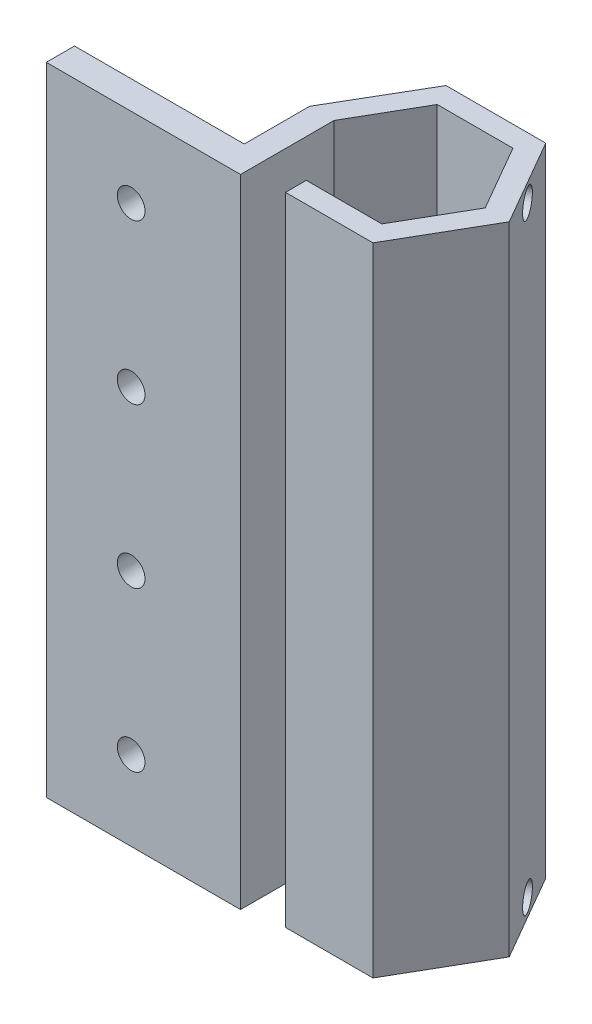
from build123d import *

# Parameters (mm, degrees)
BOSS_EXTRUDE3_DEPTH = 150
SKETCH5_R           = 3.2639
CUT_EXTRUDE1_DEPTH  = 10
SKETCH6_R           = 3.15
CUT_EXTRUDE3_DEPTH  = 10
SKETCH7_W           = 23.498155956
SKETCH7_H           = 1.599424748
SKETCH7_H_2         = 1.6
BOSS_EXTRUDE4_DEPTH = 10


with BuildPart() as part:
    # Sketch4 → Boss-Extrude3 (new body)
    with BuildSketch(Plane(origin=(0, 0, 0), x_dir=(1, 0, 0), z_dir=(0, 1, 0))):
        Polygon((-17.811255804, 0.05), (-17.811255804, -22), (-63.584758496, -22), (-63.584758496, -15.35), (-23.584758496, -15.35), (-23.584758496, 0.05), (-11.749077978, 20.35), (11.749077978, 20.35), (23.498155956, 0), (11.749077978, -20.35), (-8.862326632, -20.35), (-8.862326632, -15.45), (8.920061659, -15.45), (17.840123318, 0), (8.920061659, 15.45), (-8.920061659, 15.45), align=None)
    extrude(amount=-BOSS_EXTRUDE3_DEPTH)

    # Sketch5 → Cut-Extrude1 (cut)
    with BuildSketch(Plane(origin=(0, 0, 15.35), x_dir=(-1, 0, 0), z_dir=(0, 0, -1))):
        with Locations((43.584758496, -131.25)):
            Circle(SKETCH5_R)
        with Locations((43.584758496, -93.75)):
            Circle(SKETCH5_R)
        with Locations((43.584758496, -56.25)):
            Circle(SKETCH5_R)
        with Locations((43.584758496, -18.75)):
            Circle(SKETCH5_R)
    extrude(amount=-CUT_EXTRUDE1_DEPTH, mode=Mode.SUBTRACT)

    # Sketch6 → Cut-Extrude3 (cut)
    with BuildSketch(Plane(origin=(17.623616967, 0, -10.175), x_dir=(-0.4999999999999999, 0, -0.8660254037844387), z_dir=(0.8660254037844387, 0, -0.4999999999999999))):
        with Locations((0, -4.15)):
            Circle(SKETCH6_R)
        with Locations((0, -145.85)):
            Circle(SKETCH6_R)
    extrude(amount=-CUT_EXTRUDE3_DEPTH, mode=Mode.SUBTRACT)

    # Sketch7 → Boss-Extrude4 (add)
    with BuildSketch(Plane(origin=(17.623616967, 0, -10.175), x_dir=(-0.4999999999999999, 0, -0.8660254037844387), z_dir=(0.8660254037844387, 0, -0.4999999999999999))):
        with Locations((0, -26.499712374)):
            Rectangle(SKETCH7_W, SKETCH7_H)
        with Locations((0, -123.5)):
            Rectangle(SKETCH7_W, SKETCH7_H_2)
    extrude(amount=-BOSS_EXTRUDE4_DEPTH)


solid = part.part
